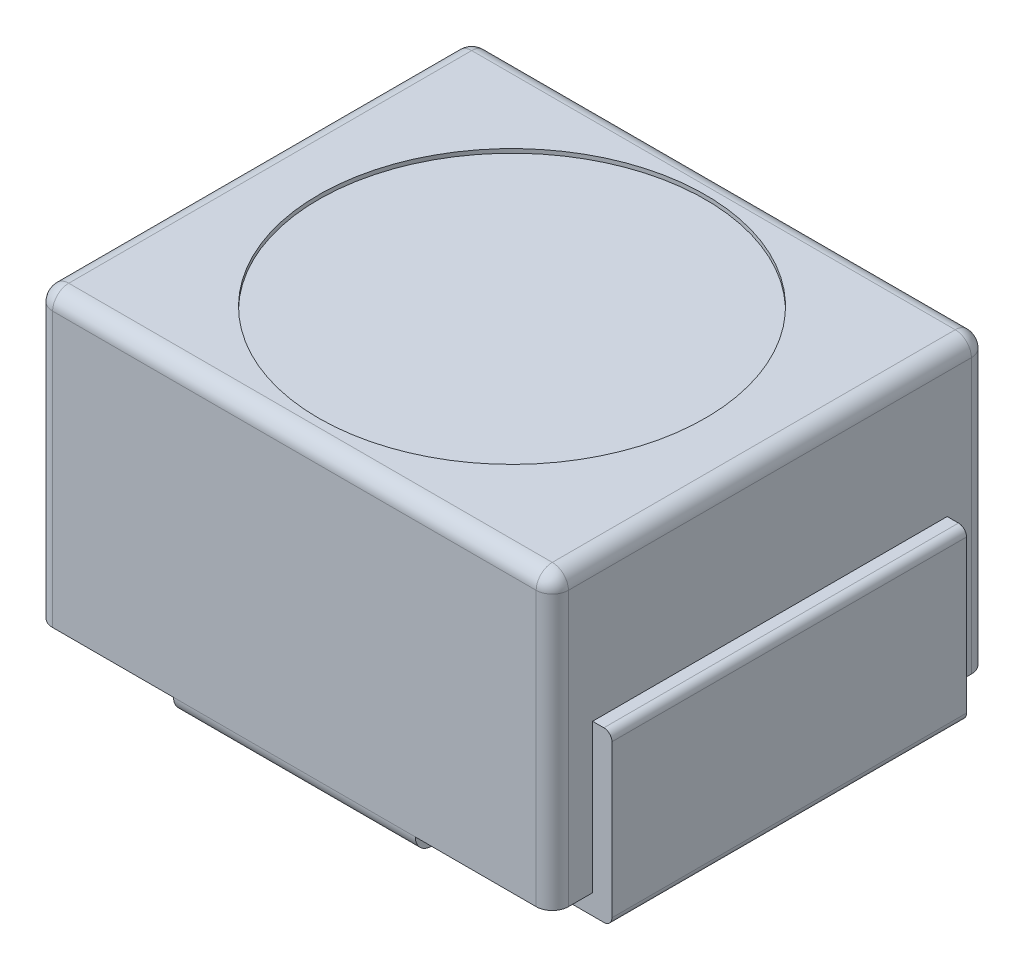
from build123d import *

# Parameters (mm, degrees)
SKETCH_2_W          = 3.2
SKETCH_2_H          = 2.7
EXTRUDE_1_DEPTH     = 1.9
FILLET_1_R          = 0.1
FILLET_2_R          = 0.1
FILLET_3_R          = 0.1
FILLET_4_R          = 0.1
FILLET_5_R          = 0.1
SKETCH_3_R          = 1.2
CUT_EXTRUDE_1_DEPTH = 0.025
SKETCH_4_W          = 0.92775498
SKETCH_4_H          = 2.835918068
CUT_EXTRUDE_2_DEPTH = 0.1
EXTRUDE_3_DEPTH     = 1.1


with BuildPart() as part:
    # Эскиз2 → Бобышка-Вытянуть1 (new body)
    with BuildSketch(Plane(origin=(0, 0, 0), x_dir=(1, 0, 0), z_dir=(0, 1, 0))):
        Rectangle(SKETCH_2_W, SKETCH_2_H)
    extrude(amount=EXTRUDE_1_DEPTH)

    # Скругление1
    fillet_1_edges = [part.edges().sort_by_distance(p)[0] for p in [
        (-1.6, 1.9, 0),
        (0, 1.9, 1.35),
        (1.6, 1.9, 0),
        (0, 1.9, -1.35),
    ]]
    fillet(fillet_1_edges, radius=FILLET_1_R)

    # Скругление2
    # the kernel refuses this fillet: 0.1 mm, written as the material it takes off along each edge
    with BuildSketch(Plane(origin=(-1.5, 1.8, 1.25), x_dir=(0, 0, 1), z_dir=(-1, 0, 0))) as fillet_2_piece_1_section:
        Polygon((0, 0), (FILLET_2_R, 0), (FILLET_2_R, FILLET_2_R), (0, FILLET_2_R), align=None)
    fillet_2_piece_1 = extrude(amount=FILLET_2_R, mode=Mode.PRIVATE)
    fillet_2_piece_1 = fillet_2_piece_1 - Plane(origin=(-1.5, 1.8, 1.25), x_dir=(0, -0.7071067811865475, -0.7071067811865475), z_dir=(-1, 0, 0)) * Sphere(FILLET_2_R, mode=Mode.PRIVATE)
    add(fillet_2_piece_1, mode=Mode.SUBTRACT)
    with BuildSketch(Plane(origin=(1.5, 1.8, 1.25), x_dir=(0, 0, 1), z_dir=(1, 0, 0))) as fillet_2_piece_2_section:
        Polygon((0, 0), (FILLET_2_R, 0), (FILLET_2_R, -FILLET_2_R), (0, -FILLET_2_R), align=None)
    fillet_2_piece_2 = extrude(amount=FILLET_2_R, mode=Mode.PRIVATE)
    fillet_2_piece_2 = fillet_2_piece_2 - Plane(origin=(1.5, 1.8, 1.25), x_dir=(0, -0.7071067811865475, -0.7071067811865475), z_dir=(1, 0, 0)) * Sphere(FILLET_2_R, mode=Mode.PRIVATE)
    add(fillet_2_piece_2, mode=Mode.SUBTRACT)
    with BuildSketch(Plane(origin=(1.6, -0.25, 1.35), x_dir=(0, 0, -1), z_dir=(0, 1, 0))) as fillet_2_piece_3:
        with BuildLine():
            CenterArc((FILLET_2_R, FILLET_2_R), FILLET_2_R, 180, 90)
            Line((0, FILLET_2_R), (0, 0))
            Line((0, 0), (FILLET_2_R, 0))
        make_face()
    extrude(amount=2.05, mode=Mode.SUBTRACT)
    with BuildSketch(Plane(origin=(-1.6, -0.25, 1.35), x_dir=(0, 0, -1), z_dir=(0, 1, 0))) as fillet_2_piece_4:
        with BuildLine():
            CenterArc((FILLET_2_R, -FILLET_2_R), FILLET_2_R, 90, 90)
            Line((0, -FILLET_2_R), (0, 0))
            Line((0, 0), (FILLET_2_R, 0))
        make_face()
    extrude(amount=2.05, mode=Mode.SUBTRACT)
    with BuildSketch(Plane(origin=(1.85, 0, 1.35), x_dir=(0, 0, -1), z_dir=(-1, 0, 0))) as fillet_2_piece_5:
        with BuildLine():
            CenterArc((FILLET_2_R, -FILLET_2_R), FILLET_2_R, 90, 90)
            Line((0, -FILLET_2_R), (0, 0))
            Line((0, 0), (FILLET_2_R, 0))
        make_face()
    extrude(amount=3.7, mode=Mode.SUBTRACT)

    # Скругление3
    # the kernel refuses this fillet: 0.1 mm, written as the material it takes off along each edge
    with BuildSketch(Plane(origin=(1.5, 1.8, -1.25), x_dir=(1, 0, 0), z_dir=(0, 0, -1))) as fillet_3_piece_1_section:
        Polygon((0, 0), (FILLET_3_R, 0), (FILLET_3_R, -FILLET_3_R), (0, -FILLET_3_R), align=None)
    fillet_3_piece_1 = extrude(amount=FILLET_3_R, mode=Mode.PRIVATE)
    fillet_3_piece_1 = fillet_3_piece_1 - Plane(origin=(1.5, 1.8, -1.25), x_dir=(-0.7071067811865475, -0.7071067811865475, 0), z_dir=(0, 0, -1)) * Sphere(FILLET_3_R, mode=Mode.PRIVATE)
    add(fillet_3_piece_1, mode=Mode.SUBTRACT)
    with BuildSketch(Plane(origin=(1.5, 0.1, 1.25), x_dir=(1, 0, 0), z_dir=(0, -1, 0))) as fillet_3_piece_2_section:
        Polygon((0, 0), (FILLET_3_R, 0), (FILLET_3_R, FILLET_3_R), (0, FILLET_3_R), align=None)
    fillet_3_piece_2 = extrude(amount=FILLET_3_R, mode=Mode.PRIVATE)
    fillet_3_piece_2 = fillet_3_piece_2 - Plane(origin=(1.5, 0.1, 1.25), x_dir=(-0.7071067811865476, 0, -0.7071067811865475), z_dir=(0, -1, 0)) * Sphere(FILLET_3_R, mode=Mode.PRIVATE)
    add(fillet_3_piece_2, mode=Mode.SUBTRACT)
    with BuildSketch(Plane(origin=(1.6, -0.25, -1.35), x_dir=(-1, 0, 0), z_dir=(0, 1, 0))) as fillet_3_piece_3:
        with BuildLine():
            CenterArc((FILLET_3_R, FILLET_3_R), FILLET_3_R, 180, 90)
            Line((0, FILLET_3_R), (0, 0))
            Line((0, 0), (FILLET_3_R, 0))
        make_face()
    extrude(amount=2.05, mode=Mode.SUBTRACT)
    with BuildSketch(Plane(origin=(1.6, 0, -1.6), x_dir=(-1, 0, 0), z_dir=(0, 0, 1))) as fillet_3_piece_4:
        with BuildLine():
            CenterArc((FILLET_3_R, -FILLET_3_R), FILLET_3_R, 90, 90)
            Line((0, -FILLET_3_R), (0, 0))
            Line((0, 0), (FILLET_3_R, 0))
        make_face()
    extrude(amount=2.85, mode=Mode.SUBTRACT)

    # Скругление4
    # the kernel refuses this fillet: 0.1 mm, written as the material it takes off along each edge
    with BuildSketch(Plane(origin=(-1.5, 1.8, -1.25), x_dir=(-1, 0, 0), z_dir=(0, 0, -1))) as fillet_4_piece_1_section:
        Polygon((0, 0), (FILLET_4_R, 0), (FILLET_4_R, FILLET_4_R), (0, FILLET_4_R), align=None)
    fillet_4_piece_1 = extrude(amount=FILLET_4_R, mode=Mode.PRIVATE)
    fillet_4_piece_1 = fillet_4_piece_1 - Plane(origin=(-1.5, 1.8, -1.25), x_dir=(0.7071067811865475, -0.7071067811865475, 0), z_dir=(0, 0, -1)) * Sphere(FILLET_4_R, mode=Mode.PRIVATE)
    add(fillet_4_piece_1, mode=Mode.SUBTRACT)
    with BuildSketch(Plane(origin=(1.5, 0.1, -1.25), x_dir=(0, -1, 0), z_dir=(0, 0, -1))) as fillet_4_piece_2_section:
        Polygon((0, 0), (FILLET_4_R, 0), (FILLET_4_R, -FILLET_4_R), (0, -FILLET_4_R), align=None)
    fillet_4_piece_2 = extrude(amount=FILLET_4_R, mode=Mode.PRIVATE)
    fillet_4_piece_2 = fillet_4_piece_2 - Plane(origin=(1.5, 0.1, -1.25), x_dir=(-0.7071067811865475, 0.7071067811865475, 0), z_dir=(0, 0, -1)) * Sphere(FILLET_4_R, mode=Mode.PRIVATE)
    add(fillet_4_piece_2, mode=Mode.SUBTRACT)
    with BuildSketch(Plane(origin=(-1.6, -0.25, -1.35), x_dir=(1, 0, 0), z_dir=(0, 1, 0))) as fillet_4_piece_3:
        with BuildLine():
            CenterArc((FILLET_4_R, -FILLET_4_R), FILLET_4_R, 90, 90)
            Line((0, -FILLET_4_R), (0, 0))
            Line((0, 0), (FILLET_4_R, 0))
        make_face()
    extrude(amount=2.05, mode=Mode.SUBTRACT)
    with BuildSketch(Plane(origin=(-1.85, 0, -1.35), x_dir=(0, 1, 0), z_dir=(1, 0, 0))) as fillet_4_piece_4:
        with BuildLine():
            CenterArc((FILLET_4_R, FILLET_4_R), FILLET_4_R, 180, 90)
            Line((0, FILLET_4_R), (0, 0))
            Line((0, 0), (FILLET_4_R, 0))
        make_face()
    extrude(amount=3.35, mode=Mode.SUBTRACT)

    # Скругление5
    # the kernel refuses this fillet: 0.1 mm, written as the material it takes off along each edge
    with BuildSketch(Plane(origin=(-1.5, 0.1, 1.25), x_dir=(-1, 0, 0), z_dir=(0, -1, 0))) as fillet_5_piece_1_section:
        Polygon((0, 0), (FILLET_5_R, 0), (FILLET_5_R, -FILLET_5_R), (0, -FILLET_5_R), align=None)
    fillet_5_piece_1 = extrude(amount=FILLET_5_R, mode=Mode.PRIVATE)
    fillet_5_piece_1 = fillet_5_piece_1 - Plane(origin=(-1.5, 0.1, 1.25), x_dir=(0.7071067811865475, 0, -0.7071067811865477), z_dir=(0, -1, 0)) * Sphere(FILLET_5_R, mode=Mode.PRIVATE)
    add(fillet_5_piece_1, mode=Mode.SUBTRACT)
    with BuildSketch(Plane(origin=(-1.5, 0.1, -1.25), x_dir=(-1, 0, 0), z_dir=(0, -1, 0))) as fillet_5_piece_2_section:
        Polygon((0, 0), (FILLET_5_R, 0), (FILLET_5_R, FILLET_5_R), (0, FILLET_5_R), align=None)
    fillet_5_piece_2 = extrude(amount=FILLET_5_R, mode=Mode.PRIVATE)
    fillet_5_piece_2 = fillet_5_piece_2 - Plane(origin=(-1.5, 0.1, -1.25), x_dir=(0.7071067811865476, 0, 0.7071067811865475), z_dir=(0, -1, 0)) * Sphere(FILLET_5_R, mode=Mode.PRIVATE)
    add(fillet_5_piece_2, mode=Mode.SUBTRACT)
    with BuildSketch(Plane(origin=(-1.6, 0, 1.25), x_dir=(1, 0, 0), z_dir=(0, 0, -1))) as fillet_5_piece_3:
        with BuildLine():
            CenterArc((FILLET_5_R, -FILLET_5_R), FILLET_5_R, 90, 90)
            Line((0, -FILLET_5_R), (0, 0))
            Line((0, 0), (FILLET_5_R, 0))
        make_face()
    extrude(amount=2.5, mode=Mode.SUBTRACT)

    # Эскиз3 → Вырез-Вытянуть1 (cut)
    with BuildSketch(Plane(origin=(0, 1.9, 0), x_dir=(1, 0, 0), z_dir=(0, 1, 0))):
        with Locations(Location((0, 0, 0), (0, 0, 270))):
            Circle(SKETCH_3_R)
    extrude(amount=-CUT_EXTRUDE_1_DEPTH, mode=Mode.SUBTRACT)

    # Эскиз4 → Вырез-Вытянуть2 (cut)
    with BuildSketch(Plane.XZ):
        with Locations((1.213877491, 0.001548995)):
            Rectangle(SKETCH_4_W, SKETCH_4_H)
        with Locations((-1.213877491, 0.001548995)):
            Rectangle(SKETCH_4_W, SKETCH_4_H)
    extrude(amount=-CUT_EXTRUDE_2_DEPTH, mode=Mode.SUBTRACT)

    # Эскиз6 → Бобышка-Вытянуть3 (add, symmetric)
    with BuildSketch(Plane(origin=(0, 0, 0), x_dir=(-1, 0, 0), z_dir=(0, 0, -1))):
        with BuildLine():
            Line((1.6, 0.1), (0.87063337, 0.1))
            Line((0.87063337, 0.1), (0.87063337, 0.025437095))
            ThreePointArc((0.87063337, 0.025437095), (0.885278031, -0.009918244), (0.92063337, -0.024562905))
            Line((0.92063337, -0.024562905), (1.67, -0.024562905))
            ThreePointArc((1.67, -0.024562905), (1.705355339, -0.009918244), (1.72, 0.025437095))
            Line((1.72, 0.025437095), (1.72, 0.971300934))
            ThreePointArc((1.72, 0.971300934), (1.705355339, 1.006656273), (1.67, 1.021300934))
            Line((1.67, 1.021300934), (1.6, 1.021300934))
            Line((1.6, 1.021300934), (1.6, 0.1))
        make_face()
        with BuildLine():
            Line((-1.6, 1.021300934), (-1.67, 1.021300934))
            ThreePointArc((-1.67, 1.021300934), (-1.705355339, 1.006656273), (-1.72, 0.971300934))
            Line((-1.72, 0.971300934), (-1.72, 0.025437095))
            ThreePointArc((-1.72, 0.025437095), (-1.705355339, -0.009918244), (-1.67, -0.024562905))
            Line((-1.67, -0.024562905), (-0.92063337, -0.024562905))
            ThreePointArc((-0.92063337, -0.024562905), (-0.885278031, -0.009918244), (-0.87063337, 0.025437095))
            Line((-0.87063337, 0.025437095), (-0.87063337, 0.1))
            Line((-0.87063337, 0.1), (-1.6, 0.1))
            Line((-1.6, 0.1), (-1.6, 1.021300934))
        make_face()
    extrude(amount=EXTRUDE_3_DEPTH, both=True)


solid = part.part
